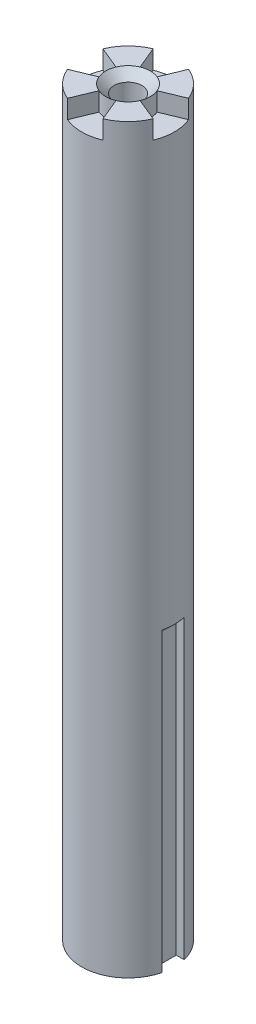
from build123d import *

# Parameters (mm, degrees)
SKETCH1_R                        = 6.35
BOSS_EXTRUDE1_DEPTH              = 101.6
CUT_EXTRUDE1_DEPTH               = 40.64
FILLET1_R                        = 1.27
F_10_24_TAPPED_HOLE1_D           = 3.7973
F_10_24_TAPPED_HOLE1_DEPTH       = 12.954
F_10_24_TAPPED_HOLE1_CSINK_D     = 6.096
F_10_24_TAPPED_HOLE1_CSINK_ANGLE = 90
F_10_24_TAPPED_HOLE1_TIP         = 1.140824014
CUT_EXTRUDE3_START               = -2.54
CUT_EXTRUDE3_DEPTH               = 2.54


with BuildPart() as part:
    # Sketch1 → Boss-Extrude1 (new body)
    with BuildSketch(Plane(origin=(0, 0, 0), x_dir=(1, 0, 0), z_dir=(0, 1, 0))):
        with Locations(Location((0, 0, 0), (0, 0, 270))):
            Circle(SKETCH1_R)
    extrude(amount=BOSS_EXTRUDE1_DEPTH)

    # Sketch2 → Cut-Extrude1 (cut)
    with BuildSketch(Plane(origin=(0, 0, 0), x_dir=(-1, 0, 0), z_dir=(0, -1, 0))):
        with BuildLine():
            Line((-6.164407839, -1.524), (-5.08, -1.524))
            Line((-5.08, -1.524), (-5.08, 1.524))
            Line((-5.08, 1.524), (-6.164407839, 1.524))
            ThreePointArc((-6.164407839, 1.524), (-6.35, 0), (-6.164407839, -1.524))
        make_face()
    extrude(amount=-CUT_EXTRUDE1_DEPTH, mode=Mode.SUBTRACT)

    # Fillet1
    fillet1_edges = [part.edges().sort_by_distance(p)[0] for p in [
        (5.08, 40.64, 0),
    ]]
    fillet(fillet1_edges, radius=FILLET1_R - 0.0001)  # a hair under: the kernel refuses the full size

    # #10-24 Tapped Hole1
    with Locations(Plane(origin=(0, 101.6, 0), x_dir=(1, 0, 0), z_dir=(0, 1, 0))):
        with Locations((0, 0)):
            CounterSinkHole(F_10_24_TAPPED_HOLE1_D / 2, F_10_24_TAPPED_HOLE1_CSINK_D / 2, depth=F_10_24_TAPPED_HOLE1_DEPTH, counter_sink_angle=F_10_24_TAPPED_HOLE1_CSINK_ANGLE)
            with Locations((0, 0, -(F_10_24_TAPPED_HOLE1_DEPTH + F_10_24_TAPPED_HOLE1_TIP / 2))):  # 118° drill point
                Cone(0, F_10_24_TAPPED_HOLE1_D / 2, F_10_24_TAPPED_HOLE1_TIP, mode=Mode.SUBTRACT)

    # Sketch6 → Cut-Extrude3 (cut)
    with BuildSketch(Plane(origin=(0, 101.6, 0), x_dir=(1, 0, 0), z_dir=(0, 1, 0)).offset(CUT_EXTRUDE3_START)):
        with BuildLine():
            Line((2.430039796, -5.866635031), (1.166419102, -2.815984815))
            ThreePointArc((1.166419102, -2.815984815), (0, -3.048), (-1.166419102, -2.815984815))
            Line((-1.166419102, -2.815984815), (-2.430039796, -5.866635031))
            ThreePointArc((-2.430039796, -5.866635031), (0, -6.35), (2.430039796, -5.866635031))
        make_face()
        with BuildLine():
            Line((-5.866635031, 2.430039796), (-2.815984815, 1.166419102))
            ThreePointArc((-2.815984815, 1.166419102), (-3.048, 0), (-2.815984815, -1.166419102))
            Line((-2.815984815, -1.166419102), (-5.866635031, -2.430039796))
            ThreePointArc((-5.866635031, -2.430039796), (-6.35, 0), (-5.866635031, 2.430039796))
        make_face()
        with BuildLine():
            Line((2.430039796, 5.866635031), (1.166419102, 2.815984815))
            ThreePointArc((1.166419102, 2.815984815), (0, 3.048), (-1.166419102, 2.815984815))
            Line((-1.166419102, 2.815984815), (-2.430039796, 5.866635031))
            ThreePointArc((-2.430039796, 5.866635031), (0, 6.35), (2.430039796, 5.866635031))
        make_face()
        with BuildLine():
            Line((5.866635031, -2.430039796), (2.815984815, -1.166419102))
            ThreePointArc((2.815984815, -1.166419102), (3.048, 0), (2.815984815, 1.166419102))
            Line((2.815984815, 1.166419102), (5.866635031, 2.430039796))
            ThreePointArc((5.866635031, 2.430039796), (6.35, 0), (5.866635031, -2.430039796))
        make_face()
    extrude(amount=CUT_EXTRUDE3_DEPTH, mode=Mode.SUBTRACT)


solid = part.part
